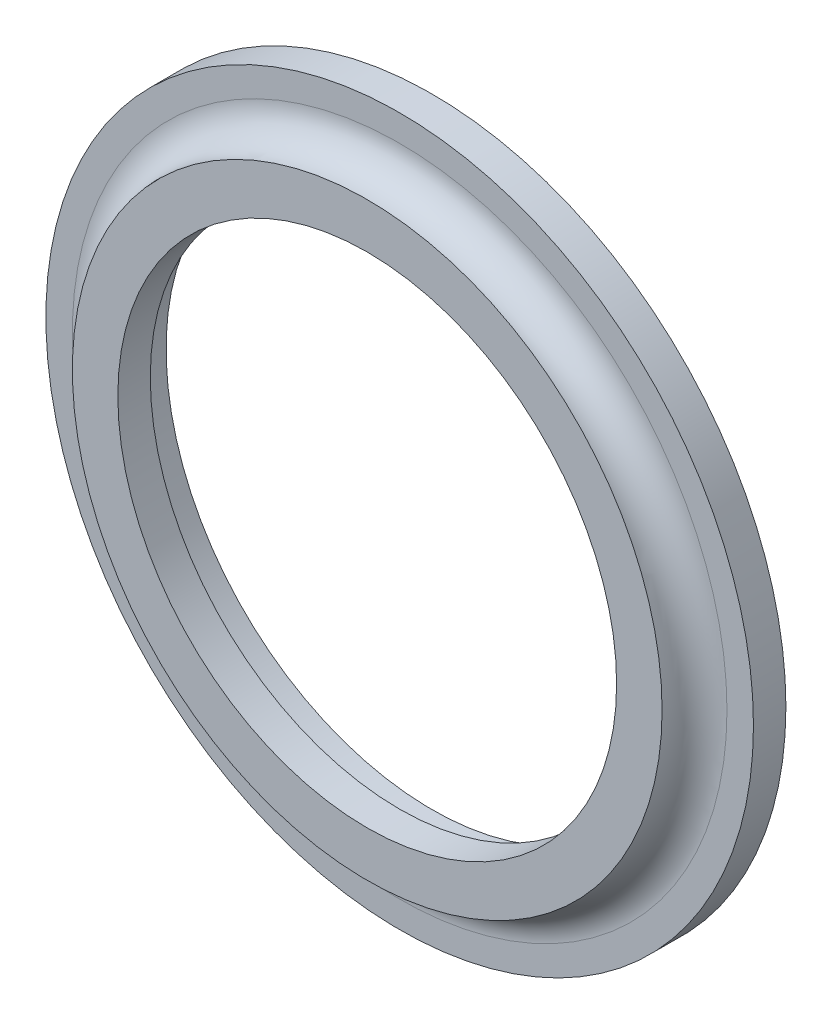
from build123d import *

# Parameters (mm, degrees)
SKETCH1_R           = 54.524863565
SKETCH1_R_2         = 41
BOSS_EXTRUDE1_DEPTH = 5
SKETCH2_R           = 45.441734001
SKETCH2_R_2         = 38.435146228
BOSS_EXTRUDE2_DEPTH = 5
FILLET1_R           = 5


with BuildPart() as part:
    # Sketch1 → Boss-Extrude1 (new body)
    with BuildSketch(Plane.XY):
        Circle(SKETCH1_R)
        Circle(SKETCH1_R_2, mode=Mode.SUBTRACT)
    extrude(amount=BOSS_EXTRUDE1_DEPTH)

    # Sketch2 → Boss-Extrude2 (add)
    with BuildSketch(Plane.XY.offset(5)):
        Circle(SKETCH2_R)
        Circle(SKETCH2_R_2, mode=Mode.SUBTRACT)
    extrude(amount=BOSS_EXTRUDE2_DEPTH)

    # Fillet1
    fillet1_edges = [part.edges().sort_by_distance(p)[0] for p in [
        (-45.441734001, 0, 5),
    ]]
    fillet(fillet1_edges, radius=FILLET1_R - 0.0001)  # a hair under: the kernel refuses the full size


solid = part.part
